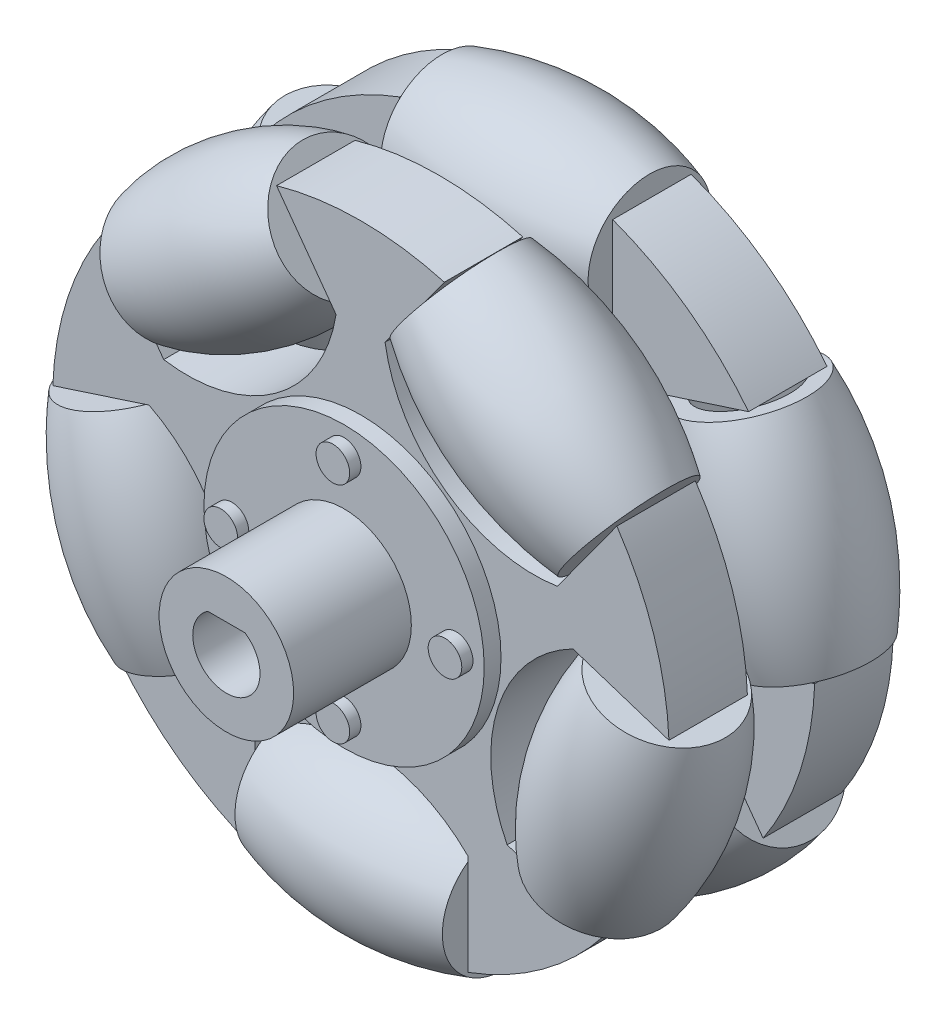
from build123d import *

# Parameters (mm, degrees)
BOSS_EXTRUDE2_DEPTH      = 3.5
BOSS_EXTRUDE5_DEPTH      = 3.5
BOSS_EXTRUDE6_DEPTH      = 5
BOSS_EXTRUDE6_DEPTH_BACK = 1
SKETCH3_30_R             = 12.5
SKETCH6_R                = 12.5
CUT_EXTRUDE3_DEPTH       = 2
BOSS_EXTRUDE9_DEPTH      = 6
BOSS_EXTRUDE9_DEPTH_BACK = 16
SKETCH3_33_R             = 1.5
SKETCH10_R               = 6
BOSS_EXTRUDE10_DEPTH     = 12
CUT_EXTRUDE4_DEPTH       = 51.813384178
CUT_EXTRUDE4_DEPTH_BACK  = 51.813384178
SKETCH11_R               = 6
CUT_EXTRUDE5_DEPTH       = 15


with BuildPart() as part:
    # Sketch1 → Revolve3 (revolve)
    with BuildSketch(Plane.XY):
        with BuildLine():
            Line((27.488521747, -0.794463438), (28.998407922, -0.303871681))
            ThreePointArc((28.998407922, -0.303871681), (27.580638973, 8.961492837), (23.281593526, 17.29067387))
            Line((23.281593526, 17.29067387), (21.771707351, 16.800082113))
            ThreePointArc((21.771707351, 16.800082113), (26.028560776, 8.874909798), (27.5, 0))
            ThreePointArc((27.5, 0), (27.497130287, -0.397273176), (27.488521747, -0.794463438))
        make_face()
    revolve(axis=Axis((18.064836163, 15.595646653, 0), (0.30901699437493513, -0.9510565162951576, 0)))



with BuildPart() as body_2:
    # Sketch1<6> → Revolve4 (revolve)
    with BuildSketch(Plane.XY):
        with BuildLine():
            Line((-9.25, 27.485223303), (-9.25, 22.000000003))
            Line((-9.25, 22.000000003), (9.25, 22.000000003))
            Line((9.25, 22.000000003), (9.25, 27.485223303))
            ThreePointArc((9.25, 27.485223303), (0, 29), (-9.25, 27.485223303))
        make_face()
    revolve(axis=Axis((-9.25, 22.000000003, 0), (1, 0, 0)))


with BuildPart() as body_3:
    # Sketch1<7> → Revolve5 (revolve)
    with BuildSketch(Plane.XY):
        with BuildLine():
            Line((-23.281593526, 17.29067387), (-18.064836163, 15.595646653))
            Line((-18.064836163, 15.595646653), (-23.781650559, -1.998898899))
            Line((-23.781650559, -1.998898899), (-28.998407922, -0.303871681))
            ThreePointArc((-28.998407922, -0.303871681), (-27.580638973, 8.961492837), (-23.281593526, 17.29067387))
        make_face()
    revolve(axis=Axis((-23.781650559, -1.998898899, 0), (0.3090169943749596, 0.9510565162951496, 0)))


with BuildPart() as body_4:
    # Sketch1<8> → Revolve6 (revolve)
    with BuildSketch(Plane.XY):
        with BuildLine():
            Line((-23.638816111, -16.798999162), (-20.41468275, -12.361360295))
            Line((-20.41468275, -12.361360295), (-5.447868354, -23.235387462))
            Line((-5.447868354, -23.235387462), (-8.672001715, -27.67302633))
            ThreePointArc((-8.672001715, -27.67302633), (-17.045772316, -23.461492837), (-23.638816111, -16.798999162))
        make_face()
    revolve(axis=Axis((-5.447868354, -23.235387462, 0), (-0.8090169943749399, 0.5877852522924835, 0)))


with BuildPart() as body_5:
    # Sketch1<9> → Revolve7 (revolve)
    with BuildSketch(Plane.XY):
        with BuildLine():
            Line((8.672001715, -27.67302633), (5.447868354, -23.235387462))
            Line((5.447868354, -23.235387462), (20.41468275, -12.361360295))
            Line((20.41468275, -12.361360295), (23.638816111, -16.798999162))
            ThreePointArc((23.638816111, -16.798999162), (17.045772316, -23.461492837), (8.672001715, -27.67302633))
        make_face()
    revolve(axis=Axis((20.41468275, -12.361360295, 0), (-0.809016994374955, -0.5877852522924628, 0)))


with BuildPart() as part_1:
    add(part.part)

    add(body_2.part)  # Boss-Extrude2 merges body 2

    add(body_3.part)  # Boss-Extrude2 merges body 3

    add(body_4.part)  # Boss-Extrude2 merges body 4

    add(body_5.part)  # Boss-Extrude2 merges body 5
    # Sketch1<10> → Boss-Extrude2 (add, symmetric)
    with BuildSketch(Plane.XY):
        with BuildLine():
            ThreePointArc((22.87697608, -15.26086385), (26.166457463, -8.459698804), (27.48107512, -1.020054043))
            Line((27.48107512, -1.020054043), (18.895132644, -3.809795864))
            ThreePointArc((18.895132644, -3.809795864), (12.217036375, 4.009250255), (13.023809751, 14.260277946))
            Line((13.023809751, 14.260277946), (21.583318397, 17.041430895))
            ThreePointArc((21.583318397, 17.041430895), (16.131531712, 22.271589181), (9.46224828, 25.820841533))
            Line((9.46224828, 25.820841533), (9.46224828, 16.79304736))
            ThreePointArc((9.46224828, 16.79304736), (-0.03775172, 12.858018518), (-9.53775172, 16.79304736))
            Line((-9.53775172, 16.79304736), (-9.53775172, 25.79304736))
            ThreePointArc((-9.53775172, 25.79304736), (-16.196622574, 22.224297901), (-21.633084073, 16.978211728))
            Line((-21.633084073, 16.978211728), (-13.047141597, 14.188469907))
            ThreePointArc((-13.047141597, 14.188469907), (-12.240368221, 3.937442217), (-18.91846449, -3.881603902))
            Line((-18.91846449, -3.881603902), (-27.477973137, -1.100450953))
            ThreePointArc((-27.477973137, -1.100450953), (-26.141594966, -8.536217702), (-22.832229519, -15.327729617))
            Line((-22.832229519, -15.327729617), (-17.525825243, -8.024090709))
            ThreePointArc((-17.525825243, -8.024090709), (-7.527211875, -10.424545399), (-2.15450235, -19.192010503))
            Line((-2.15450235, -19.192010503), (-7.44456962, -26.473163452))
            ThreePointArc((-7.44456962, -26.473163452), (0.040228365, -27.499970576), (7.521990192, -26.451269602))
            Line((7.521990192, -26.451269602), (2.215585916, -19.147630694))
            ThreePointArc((2.215585916, -19.147630694), (7.588295441, -10.380165591), (17.586908809, -7.979710901))
            Line((17.586908809, -7.979710901), (22.87697608, -15.26086385))
        make_face()
    extrude(amount=BOSS_EXTRUDE2_DEPTH, both=True)

    # Sketch6 → Cut-Extrude3 (cut)
    with BuildSketch(Plane(origin=(0, 0, -3.5), x_dir=(-1, 0, 0), z_dir=(0, 0, -1))):
        Circle(SKETCH6_R)
    extrude(amount=-CUT_EXTRUDE3_DEPTH, mode=Mode.SUBTRACT)



with BuildPart() as body_2_2:
    # Sketch3 → Boss-Extrude5 (new, symmetric)
    with BuildSketch(Plane.XY.offset(13)):
        with BuildLine():
            Line((-22.87697608, 15.26086385), (-17.586908809, 7.979710901))
            ThreePointArc((-17.586908809, 7.979710901), (-7.588295441, 10.380165591), (-2.215585916, 19.147630694))
            Line((-2.215585916, 19.147630694), (-7.521990192, 26.451269602))
            ThreePointArc((-7.521990192, 26.451269602), (-0.040228365, 27.499970576), (7.44456962, 26.473163452))
            Line((7.44456962, 26.473163452), (2.15450235, 19.192010503))
            ThreePointArc((2.15450235, 19.192010503), (7.527211875, 10.424545399), (17.525825243, 8.024090709))
            Line((17.525825243, 8.024090709), (22.832229519, 15.327729617))
            ThreePointArc((22.832229519, 15.327729617), (26.141594966, 8.536217702), (27.477973137, 1.100450953))
            Line((27.477973137, 1.100450953), (18.91846449, 3.881603902))
            ThreePointArc((18.91846449, 3.881603902), (12.240368221, -3.937442217), (13.047141597, -14.188469907))
            Line((13.047141597, -14.188469907), (21.633084073, -16.978211728))
            ThreePointArc((21.633084073, -16.978211728), (16.196622574, -22.224297901), (9.53775172, -25.79304736))
            Line((9.53775172, -25.79304736), (9.53775172, -16.79304736))
            ThreePointArc((9.53775172, -16.79304736), (0.03775172, -12.858018518), (-9.46224828, -16.79304736))
            Line((-9.46224828, -16.79304736), (-9.46224828, -25.820841533))
            ThreePointArc((-9.46224828, -25.820841533), (-16.131531712, -22.271589181), (-21.583318397, -17.041430895))
            Line((-21.583318397, -17.041430895), (-13.023809751, -14.260277946))
            ThreePointArc((-13.023809751, -14.260277946), (-12.217036375, -4.009250255), (-18.895132644, 3.809795864))
            Line((-18.895132644, 3.809795864), (-27.48107512, 1.020054043))
            ThreePointArc((-27.48107512, 1.020054043), (-26.166457463, 8.459698804), (-22.87697608, 15.26086385))
        make_face()
    extrude(amount=BOSS_EXTRUDE5_DEPTH, both=True)

    # Sketch3<25> → Revolve14 (revolve)
    with BuildSketch(Plane.XY.offset(13)):
        with BuildLine():
            Line((23.638816111, 16.798999162), (20.41468275, 12.361360295))
            Line((20.41468275, 12.361360295), (5.447868354, 23.235387462))
            Line((5.447868354, 23.235387462), (8.672001715, 27.67302633))
            ThreePointArc((8.672001715, 27.67302633), (17.045772316, 23.461492837), (23.638816111, 16.798999162))
        make_face()
    revolve(axis=Axis((5.447868354, 23.235387462, 13), (0.80901699437494, -0.5877852522924834, 0)))

    # Sketch3<26> → Revolve15 (revolve)
    with BuildSketch(Plane.XY.offset(13)):
        with BuildLine():
            Line((23.281593526, -17.29067387), (18.064836163, -15.595646653))
            Line((18.064836163, -15.595646653), (23.781650559, 1.998898899))
            Line((23.781650559, 1.998898899), (28.998407922, 0.303871681))
            ThreePointArc((28.998407922, 0.303871681), (27.580638973, -8.961492837), (23.281593526, -17.29067387))
        make_face()
    revolve(axis=Axis((23.781650559, 1.998898899, 13), (-0.3090169943749462, -0.951056516295154, 0)))

    # Sketch3<27> → Revolve16 (revolve)
    with BuildSketch(Plane.XY.offset(13)):
        with BuildLine():
            Line((-23.638816111, 16.798999162), (-20.41468275, 12.361360295))
            Line((-20.41468275, 12.361360295), (-5.447868354, 23.235387462))
            Line((-5.447868354, 23.235387462), (-8.672001715, 27.67302633))
            ThreePointArc((-8.672001715, 27.67302633), (-17.045772316, 23.461492837), (-23.638816111, 16.798999162))
        make_face()
    revolve(axis=Axis((-20.41468275, 12.361360295, 13), (0.8090169943749468, 0.5877852522924741, 0)))

    # Sketch3<28> → Revolve17 (revolve)
    with BuildSketch(Plane.XY.offset(13)):
        with BuildLine():
            Line((-28.998407922, 0.303871681), (-23.781650559, 1.998898899))
            Line((-23.781650559, 1.998898899), (-18.064836163, -15.595646653))
            Line((-18.064836163, -15.595646653), (-23.281593526, -17.29067387))
            ThreePointArc((-23.281593526, -17.29067387), (-27.580638973, -8.961492837), (-28.998407922, 0.303871681))
        make_face()
    revolve(axis=Axis((-18.064836163, -15.595646653, 13), (-0.3090169943749486, 0.9510565162951532, 0)))

    # Sketch3<29> → Revolve18 (revolve)
    with BuildSketch(Plane.XY.offset(13)):
        with BuildLine():
            Line((-9.25, -27.485223303), (-9.25, -22.000000003))
            Line((-9.25, -22.000000003), (9.25, -22.000000003))
            Line((9.25, -22.000000003), (9.25, -27.485223303))
            ThreePointArc((9.25, -27.485223303), (0, -29), (-9.25, -27.485223303))
        make_face()
    revolve(axis=Axis((9.25, -22.000000003, 13), (-1, 0, 0)))

    # Sketch3<30> → Boss-Extrude6 (add, two sides: drawn at the far end of the back side and taken through both)
    with BuildSketch(Plane.XY.offset(13).offset(-BOSS_EXTRUDE6_DEPTH_BACK)):
        Circle(SKETCH3_30_R)
    extrude(amount=BOSS_EXTRUDE6_DEPTH + BOSS_EXTRUDE6_DEPTH_BACK)


with BuildPart() as part_2:
    add(part_1.part)

    add(body_2_2.part)  # Boss-Extrude9 merges body 2 2
    # Sketch3<33> → Boss-Extrude9 (add, two sides: drawn at the far end of the back side and taken through both)
    with BuildSketch(Plane.XY.offset(13).offset(-BOSS_EXTRUDE9_DEPTH_BACK)):
        with Locations((0, 10)):
            Circle(SKETCH3_33_R)
        with Locations((10, 0)):
            Circle(SKETCH3_33_R)
        with Locations((0, -10)):
            Circle(SKETCH3_33_R)
        with Locations((-10, 0)):
            Circle(SKETCH3_33_R)
    extrude(amount=BOSS_EXTRUDE9_DEPTH + BOSS_EXTRUDE9_DEPTH_BACK)

    # Sketch10 → Boss-Extrude10 (add)
    with BuildSketch(Plane.XY.offset(16.5)):
        Circle(SKETCH10_R)
    extrude(amount=BOSS_EXTRUDE10_DEPTH)

    # Sketch9 → Cut-Extrude4 (cut, two sides: drawn at the far end of the back side and taken through both)
    with BuildSketch(Plane(origin=(0, 0, -1.5), x_dir=(-1, 0, 0), z_dir=(0, 0, -1)).offset(-CUT_EXTRUDE4_DEPTH_BACK)):
        with BuildLine():
            Line((1.658312395, 2.5), (-1.658312395, 2.5))
            ThreePointArc((-1.658312395, 2.5), (0, -3), (1.658312395, 2.5))
        make_face()
    extrude(amount=CUT_EXTRUDE4_DEPTH + CUT_EXTRUDE4_DEPTH_BACK, mode=Mode.SUBTRACT)

    # Sketch11 → Cut-Extrude5 (cut)
    with BuildSketch(Plane(origin=(0, 0, -1.5), x_dir=(-1, 0, 0), z_dir=(0, 0, -1))):
        Circle(SKETCH11_R)
    extrude(amount=-CUT_EXTRUDE5_DEPTH, mode=Mode.SUBTRACT)


solid = part_2.part
